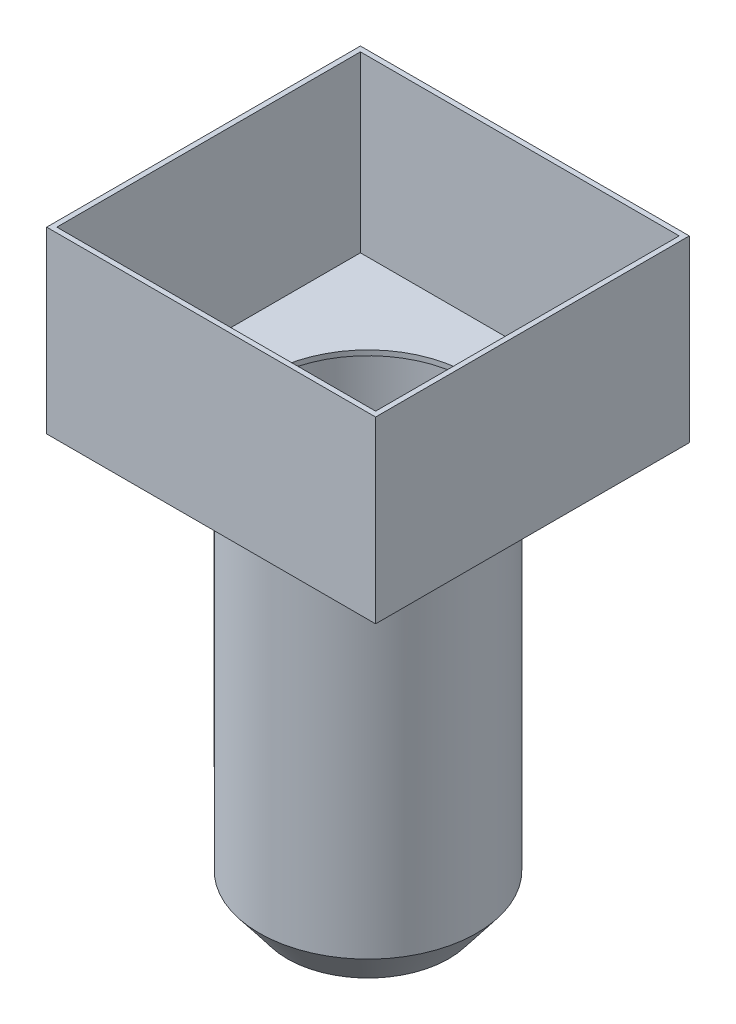
from build123d import *

# Parameters (mm, degrees)
SHELL3_T                 = 0.1
BOSS_EXTRUDE1_DEPTH      = 3.1
BOSS_EXTRUDE1_DEPTH_BACK = 3.1
SKETCH1_3_W              = 3.25
SKETCH1_3_H              = 3.54
SHELL4_START             = -3
SHELL4_OUTLINE_W         = 6.3
SHELL4_OUTLINE_H         = 3.44
SHELL4_DEPTH             = 6
SKETCH2_R                = 2
CUT_EXTRUDE2_DEPTH       = 0.1


# Read off the part's stored shape, not the designer's step: Shell4
with BuildPart() as part:
    # Sketch1 → Revolve2 (revolve)
    with BuildSketch(Plane.XY, mode=Mode.PRIVATE) as revolve2_sk:
        Polygon((0, 0), (-2.05, 0), (-2.05, -7.36), (-1.469693846, -8.11), (0, -8.11), align=None)
    revolve(revolve2_sk.sketch.rotate(Axis((0, 19.440747496, 0), (0, -1, 0)), 270), axis=Axis((0, 19.440747496, 0), (0, -1, 0)))

    # Shell3
    shell3_openings = [part.faces().sort_by_distance(p)[0] for p in [
        (0, 0, 0),
        (0, -8.11, 0),
    ]]
    offset(amount=SHELL3_T, openings=shell3_openings, kind=Kind.INTERSECTION)

    # Sketch1<3> → Boss-Extrude1 (add, two sides: drawn at the far end of the back side and taken through both)
    with BuildSketch(Plane.XY.offset(-BOSS_EXTRUDE1_DEPTH_BACK)):
        Polygon((-3.25, 3.54), (-3.25, 0), (-2.05, 0), (0, 0), (0, 3.54), align=None)
        with Locations((1.625, 1.77)):
            Rectangle(SKETCH1_3_W, SKETCH1_3_H)
    extrude(amount=BOSS_EXTRUDE1_DEPTH + BOSS_EXTRUDE1_DEPTH_BACK)

    # Shell4 outline → Shell4 (cut)
    with BuildSketch(Plane.XY.offset(SHELL4_START)):
        with Locations((0, 1.82)):
            Rectangle(SHELL4_OUTLINE_W, SHELL4_OUTLINE_H)
    extrude(amount=SHELL4_DEPTH, mode=Mode.SUBTRACT)

    # Sketch2 → Cut-Extrude2 (cut)
    with BuildSketch(Plane(origin=(0, 0.1, 0), x_dir=(1, 0, 0), z_dir=(0, 1, 0))):
        with Locations(Location((0, 0, 0), (0, 0, 270))):
            Circle(SKETCH2_R)
    extrude(amount=-CUT_EXTRUDE2_DEPTH, mode=Mode.SUBTRACT)


solid = part.part
